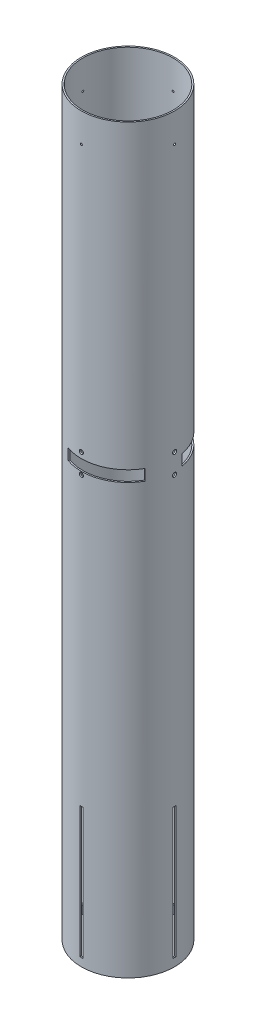
from build123d import *

# Parameters (mm, degrees)
SKETCH1_R              = 51.1048
SKETCH1_R_2            = 49.53
BOSS_EXTRUDE1_DEPTH    = 812.8
CUT_EXTRUDE1_DEPTH     = 817.00688794
CIRPATTERN1_COUNT      = 4
CUT_EXTRUDE2_DEPTH     = 817.00688794
CIRPATTERN2_COUNT      = 4
SKETCH3_R              = 3.175
CUT_EXTRUDE3_DEPTH     = 817.006888054
CUT_EXTRUDE4_START     = 470.535
CUT_EXTRUDE4_DEPTH     = 12.065
CIRPATTERN3_COUNT      = 3
LPATTERN1_COPY_1_DEPTH = 817.00688794
LPATTERN1_COPY_2_DEPTH = 817.00688794
LPATTERN1_COPY_3_DEPTH = 817.00688794
LPATTERN1_COPY_4_DEPTH = 817.00688794
SKETCH8_R              = 1.0922
CUT_EXTRUDE5_DEPTH     = 817.006888054
CIRPATTERN4_COUNT      = 4
SKETCH18_W             = 6.54812
SKETCH18_H             = 51.1048


with BuildPart() as part:
    # Sketch1 → Boss-Extrude1 (new body)
    with BuildSketch(Plane(origin=(0, 0, 0), x_dir=(1, 0, 0), z_dir=(0, 1, 0))):
        Circle(SKETCH1_R)
        Circle(SKETCH1_R_2, mode=Mode.SUBTRACT)
    extrude(amount=BOSS_EXTRUDE1_DEPTH)

    # Sketch2 → Cut-Extrude1 (cut, through all)
    with BuildSketch(Plane(origin=(0, 0, 0), x_dir=(0, 0, -1), z_dir=(1, 0, 0))):
        Polygon((0, 8.89), (1.5875, 8.89), (1.5875, 152.4), (-1.5875, 152.4), (-1.5875, 8.89), align=None)
    cut_extrude1 = extrude(amount=-CUT_EXTRUDE1_DEPTH, mode=Mode.SUBTRACT)

    # CirPattern1: Cut-Extrude1 ×4 about axis
    cirpattern1_axis = Axis((0, 0, 0), (0, 1, 0))
    for i in range(1, CIRPATTERN1_COUNT):
        add(cut_extrude1.rotate(cirpattern1_axis, i * 360 / CIRPATTERN1_COUNT), mode=Mode.SUBTRACT)

    # Sketch2<3> → Cut-Extrude2 (cut, through all)
    with BuildSketch(Plane(origin=(0, 0, 0), x_dir=(0, 0, -1), z_dir=(1, 0, 0))):
        with BuildLine():
            ThreePointArc((0, 491.199999945), (-1.590990219, 487.359009781), (2.249999945, 488.95))
            ThreePointArc((2.249999945, 488.95), (1.590990219, 490.540990219), (0, 491.199999945))
        make_face()
    cut_extrude2 = extrude(amount=-CUT_EXTRUDE2_DEPTH, mode=Mode.SUBTRACT)

    # CirPattern2: Cut-Extrude2 ×4 about axis
    cirpattern2_axis = Axis((0, 812.8, 0), (0, -1, 0))
    for i in range(1, CIRPATTERN2_COUNT):
        add(cut_extrude2.rotate(cirpattern2_axis, i * 360 / CIRPATTERN2_COUNT), mode=Mode.SUBTRACT)

    # Sketch3 → Cut-Extrude3 (cut, through all)
    with BuildSketch(Plane(origin=(0, 0, 0), x_dir=(0.7071067811865477, 0, -0.7071067811865475), z_dir=(0.7071067811865475, 0, 0.7071067811865477))):
        with Locations((0, 127)):
            Circle(SKETCH3_R)
    extrude(amount=-CUT_EXTRUDE3_DEPTH, mode=Mode.SUBTRACT)

    # Sketch7 → Cut-Extrude4 (cut)
    with BuildSketch(Plane(origin=(0, 0, 0), x_dir=(1, 0, 0), z_dir=(0, 1, 0)).offset(CUT_EXTRUDE4_START)):
        with BuildLine():
            Line((-44.258055055, -25.5524), (-42.894238249, -24.765))
            ThreePointArc((-42.894238249, -24.765), (-48.777528007, 8.60079424), (-31.837270308, 37.942181268))
            Line((-31.837270308, 37.942181268), (-32.849532236, 39.148548057))
            ThreePointArc((-32.849532236, 39.148548057), (-45.829888074, 22.612428931), (-51.055245404, 2.249999945))
            ThreePointArc((-51.055245404, 2.249999945), (-51.1048, 0), (-51.055245404, -2.249999945))
            ThreePointArc((-51.055245404, -2.249999945), (-49.060236172, -14.310618779), (-44.258055055, -25.5524))
        make_face()
    cut_extrude4 = extrude(amount=CUT_EXTRUDE4_DEPTH, mode=Mode.SUBTRACT)

    # CirPattern3: Cut-Extrude4 ×3 about axis
    cirpattern3_axis = Axis((0, 812.8, 0), (0, -1, 0))
    for i in range(1, CIRPATTERN3_COUNT):
        add(cut_extrude4.rotate(cirpattern3_axis, i * 360 / CIRPATTERN3_COUNT), mode=Mode.SUBTRACT)

    # LPattern1 copy 1 sketch → LPattern1 copy 1 (cut, through all)
    with BuildSketch(Plane(origin=(0, -21.6916, 0), x_dir=(1, 0, 0), z_dir=(0, 0, 1))):
        with BuildLine():
            ThreePointArc((0, 491.199999945), (-1.590990219, 487.359009781), (2.249999945, 488.95))
            ThreePointArc((2.249999945, 488.95), (1.590990219, 490.540990219), (0, 491.199999945))
        make_face()
    extrude(amount=-LPATTERN1_COPY_1_DEPTH, mode=Mode.SUBTRACT)

    # LPattern1 copy 2 sketch → LPattern1 copy 2 (cut, through all)
    with BuildSketch(Plane(origin=(0, -21.6916, 0), x_dir=(0, 0, 1), z_dir=(-1, 0, 0))):
        with BuildLine():
            ThreePointArc((0, 491.199999945), (-1.590990219, 487.359009781), (2.249999945, 488.95))
            ThreePointArc((2.249999945, 488.95), (1.590990219, 490.540990219), (0, 491.199999945))
        make_face()
    extrude(amount=-LPATTERN1_COPY_2_DEPTH, mode=Mode.SUBTRACT)

    # LPattern1 copy 3 sketch → LPattern1 copy 3 (cut, through all)
    with BuildSketch(Plane(origin=(0, -21.6916, 0), x_dir=(-1, 0, 0), z_dir=(0, 0, -1))):
        with BuildLine():
            ThreePointArc((0, 491.199999945), (-1.590990219, 487.359009781), (2.249999945, 488.95))
            ThreePointArc((2.249999945, 488.95), (1.590990219, 490.540990219), (0, 491.199999945))
        make_face()
    extrude(amount=-LPATTERN1_COPY_3_DEPTH, mode=Mode.SUBTRACT)

    # LPattern1 copy 4 sketch → LPattern1 copy 4 (cut, through all)
    with BuildSketch(Plane(origin=(0, -21.6916, 0), x_dir=(0, 0, -1), z_dir=(1, 0, 0))):
        with BuildLine():
            ThreePointArc((0, 491.199999945), (-1.590990219, 487.359009781), (2.249999945, 488.95))
            ThreePointArc((2.249999945, 488.95), (1.590990219, 490.540990219), (0, 491.199999945))
        make_face()
    extrude(amount=-LPATTERN1_COPY_4_DEPTH, mode=Mode.SUBTRACT)

    # Sketch8 → Cut-Extrude5 (cut, through all)
    with BuildSketch(Plane.XY):
        with Locations((0, 781.05)):
            Circle(SKETCH8_R)
    cut_extrude5 = extrude(amount=-CUT_EXTRUDE5_DEPTH, mode=Mode.SUBTRACT)

    # CirPattern4: Cut-Extrude5 ×4 about axis
    cirpattern4_axis = Axis((0, 812.8, 0), (0, -1, 0))
    for i in range(1, CIRPATTERN4_COUNT):
        add(cut_extrude5.rotate(cirpattern4_axis, i * 360 / CIRPATTERN4_COUNT), mode=Mode.SUBTRACT)

    # Sketch18 → 1/2 Clearance Hole4 (revolve, cut)
    with BuildSketch(Plane(origin=(0, 752.856, 0), x_dir=(0, -1, 0), z_dir=(1, 0, 0))):
        with Locations((3.27406, 25.5524)):
            Rectangle(SKETCH18_W, SKETCH18_H)
    revolve(axis=Axis((0, 752.856, 6.35), (0, 0, -1)), mode=Mode.SUBTRACT)


solid = part.part
